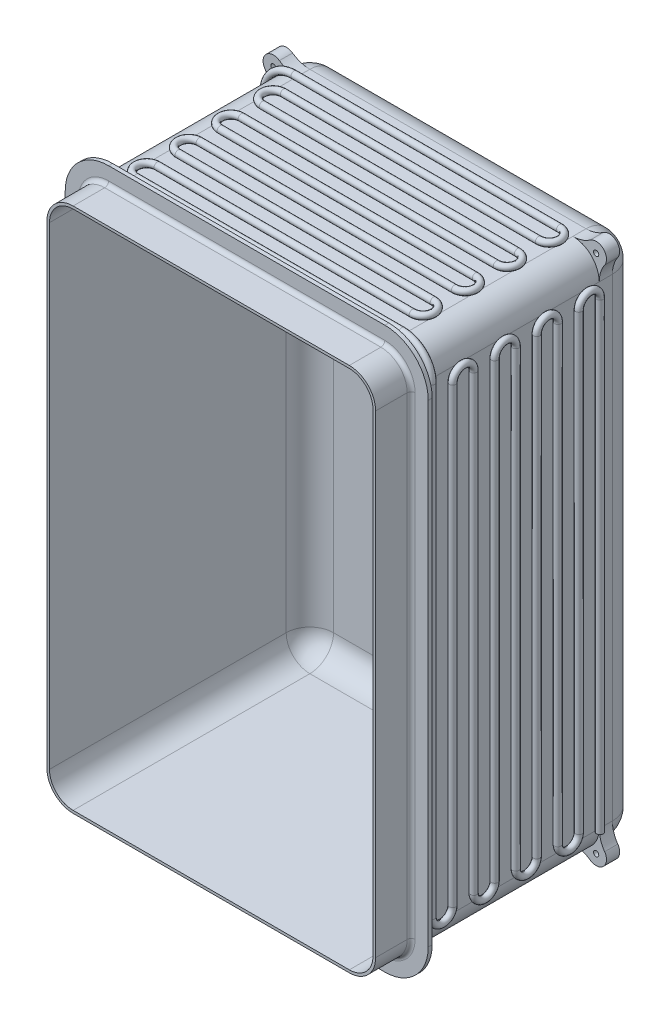
from build123d import *

# Parameters (mm, degrees)
SKIZZE1_W                       = 250
SKIZZE1_H                       = 400
AUFSATZ_LINEAR_AUSTRAGEN1_DEPTH = 200
VERRUNDUNG1_R                   = 20
WANDUNG1_T                      = -2
AUSTRAGUNG_D_NN2_PROFILE_R      = 2.5
AUSTRAGUNG_D_NN2_PROFILE_R_2    = 2
AUFSATZ_LINEAR_START            = -30
SKIZZE67_R                      = 2
AUFSATZ_LINEAR_AUSTRAGEN2_DEPTH = 10
SPIEGELN3_START                 = -30
SPIEGELN3_COPY_1_SKETCH_R       = 2
SPIEGELN3_COPY_1_DEPTH          = 10
AUFSATZ_LINEAR_START_2          = 3
AUFSATZ_LINEAR_AUSTRAGEN3_DEPTH = 3
VERRUNDUNG2_R                   = 3
VERRUNDUNG3_R                   = 3
SCHNITT_AUSTRAGUNG1_PROFILE_R   = 1.5


with BuildPart() as part:
    # Skizze1 → Aufsatz-Linear austragen1 (new body)
    with BuildSketch(Plane.XY):
        Rectangle(SKIZZE1_W, SKIZZE1_H)
    extrude(amount=AUFSATZ_LINEAR_AUSTRAGEN1_DEPTH)

    # Verrundung1
    verrundung1_edges = [part.edges().sort_by_distance(p)[0] for p in [
        (0, -200, 0),
        (-125, 0, 0),
        (0, 200, 0),
        (125, 0, 0),
        (125, -200, 100),
        (-125, -200, 100),
        (-125, 200, 100),
        (125, 200, 100),
    ]]
    fillet(verrundung1_edges, radius=VERRUNDUNG1_R)

    # Wandung1
    wandung1_openings = [part.faces().sort_by_distance(p)[0] for p in [
        (0, 0, 200),
    ]]
    offset(amount=WANDUNG1_T, openings=wandung1_openings, kind=Kind.INTERSECTION)

    # Skizze67 → Aufsatz-Linear austragen2 (add)
    with BuildSketch(Plane(origin=(0, 0, 0), x_dir=(-1, 0, 0), z_dir=(0, 0, -1)).offset(AUFSATZ_LINEAR_START)):
        with BuildLine():
            ThreePointArc((-105, 200), (-111.896608324, 201.060398611), (-118.156105762, 204.14363448))
            ThreePointArc((-118.156105762, 204.14363448), (-128.25679319, 203.25679319), (-129.14363448, 193.156105762))
            ThreePointArc((-129.14363448, 193.156105762), (-126.060398611, 186.896608324), (-125, 180))
            ThreePointArc((-125, 180), (-119.142135624, 194.142135624), (-105, 200))
        make_face()
        with Locations((-122.67766953, 197.67766953)):
            Circle(SKIZZE67_R, mode=Mode.SUBTRACT)
    aufsatz_linear_austragen2 = extrude(amount=AUFSATZ_LINEAR_AUSTRAGEN2_DEPTH)

    # Spiegeln2: Aufsatz-Linear austragen2 across plane
    add(aufsatz_linear_austragen2.mirror(Plane.ZX))

    # Spiegeln3: Aufsatz-Linear austragen2 across plane
    add(aufsatz_linear_austragen2.mirror(Plane(origin=(0, 0, 0), x_dir=(0, 0, 1), z_dir=(1, 0, 0))))

    # Spiegeln3 copy 1 sketch → Spiegeln3 copy 1 (add)
    with BuildSketch(Plane(origin=(0, 0, 0), x_dir=(1, 0, 0), z_dir=(0, 0, -1)).offset(SPIEGELN3_START)):
        with BuildLine():
            ThreePointArc((-105, 200), (-111.896608324, 201.060398611), (-118.156105762, 204.14363448))
            ThreePointArc((-118.156105762, 204.14363448), (-128.25679319, 203.25679319), (-129.14363448, 193.156105762))
            ThreePointArc((-129.14363448, 193.156105762), (-126.060398611, 186.896608324), (-125, 180))
            ThreePointArc((-125, 180), (-119.142135624, 194.142135624), (-105, 200))
        make_face()
        with Locations((-122.67766953, 197.67766953)):
            Circle(SPIEGELN3_COPY_1_SKETCH_R, mode=Mode.SUBTRACT)
    extrude(amount=SPIEGELN3_COPY_1_DEPTH)

    # Skizze69 → Aufsatz-Linear austragen3 (add)
    with BuildSketch(Plane.XY.offset(170).offset(AUFSATZ_LINEAR_START_2)):
        with BuildLine():
            Line((-105, -213), (105, -213))
            ThreePointArc((105, -213), (128.334523779, -203.334523779), (138, -180))
            Line((138, -180), (138, 180))
            ThreePointArc((138, 180), (128.334523779, 203.334523779), (105, 213))
            Line((105, 213), (-105, 213))
            ThreePointArc((-105, 213), (-128.334523779, 203.334523779), (-138, 180))
            Line((-138, 180), (-138, -180))
            ThreePointArc((-138, -180), (-128.334523779, -203.334523779), (-105, -213))
        make_face()
        with BuildLine():
            Line((-105, -200), (105, -200))
            ThreePointArc((105, -200), (119.142135624, -194.142135624), (125, -180))
            Line((125, -180), (125, 180))
            ThreePointArc((125, 180), (119.142135624, 194.142135624), (105, 200))
            Line((105, 200), (-105, 200))
            ThreePointArc((-105, 200), (-119.142135624, 194.142135624), (-125, 180))
            Line((-125, 180), (-125, -180))
            ThreePointArc((-125, -180), (-119.142135624, -194.142135624), (-105, -200))
        make_face(mode=Mode.SUBTRACT)
    extrude(amount=-AUFSATZ_LINEAR_AUSTRAGEN3_DEPTH)

    # Verrundung2
    verrundung2_edges = [part.edges().sort_by_distance(p)[0] for p in [
        (-119.142135624, -194.142135624, 173),
        (0, -200, 173),
        (119.142135624, -194.142135624, 173),
        (125, 0, 173),
        (119.142135624, 194.142135624, 173),
        (0, 200, 173),
        (-119.142135624, 194.142135624, 173),
        (-125, 0, 173),
    ]]
    fillet(verrundung2_edges, radius=VERRUNDUNG2_R)

    # Verrundung3
    verrundung3_edges = [part.edges().sort_by_distance(p)[0] for p in [
        (-119.142135624, -194.142135624, 170),
        (0, -200, 170),
        (119.142135624, -194.142135624, 170),
        (125, 0, 170),
        (119.142135624, 194.142135624, 170),
        (0, 200, 170),
        (-119.142135624, 194.142135624, 170),
        (-125, 0, 170),
    ]]
    fillet(verrundung3_edges, radius=VERRUNDUNG3_R)

    # Schnitt-Austragung1: sweep along a path in Skizze70
    with BuildLine(Plane(origin=(0, 0, 170), x_dir=(-1, 0, 0), z_dir=(0, 0, -1))) as schnitt_austragung1_path:
        Line((105, 209), (-105, 209))
        ThreePointArc((-105, 209), (-125.506096654, 200.506096654), (-134, 180))
        Line((-134, 180), (-134, -180))
        ThreePointArc((-134, -180), (-125.506096654, -200.506096654), (-105, -209))
        Line((-105, -209), (105, -209))
        ThreePointArc((105, -209), (125.506096654, -200.506096654), (134, -180))
        Line((134, -180), (134, 180))
        ThreePointArc((134, 180), (125.506096654, 200.506096654), (105, 209))
    # Schnitt-Austragung1 profile (on start of the path) → Schnitt-Austragung1 (sweep, cut)
    with BuildSketch(Plane(origin=(-105, 209, 170), x_dir=(0, 1, 0), z_dir=(1, 0, 0))):
        Circle(SCHNITT_AUSTRAGUNG1_PROFILE_R)
    sweep(path=schnitt_austragung1_path.line, mode=Mode.SUBTRACT)


with BuildPart() as body_2:
    # Austragung-Dünn2: sweep along a curve in space
    with BuildLine() as austragung_d_nn2_path:
        Line((127.5, -172, 32), (127.5, -180, 32))
        Line((127.5, 172, 32), (127.5, -172, 32))
        ThreePointArc((127.5, 172, 32), (127.5, 180, 40), (127.5, 172, 48))
        Line((127.5, -172, 48), (127.5, 172, 48))
        ThreePointArc((127.5, -172, 64), (127.5, -180, 56), (127.5, -172, 48))
        Line((127.5, 172, 64), (127.5, -172, 64))
        ThreePointArc((127.5, 172, 64), (127.5, 180, 72), (127.5, 172, 80))
        Line((127.5, -172, 80), (127.5, 172, 80))
        ThreePointArc((127.5, -172, 96), (127.5, -180, 88), (127.5, -172, 80))
        Line((127.5, 172, 96), (127.5, -172, 96))
        ThreePointArc((127.5, 172, 96), (127.5, 180, 104), (127.5, 172, 112))
        Line((127.5, -172, 112), (127.5, 172, 112))
        ThreePointArc((127.5, -172, 128), (127.5, -180, 120), (127.5, -172, 112))
        Line((127.5, 172, 128), (127.5, -172, 128))
        ThreePointArc((127.5, 172, 128), (127.5, 180, 136), (127.5, 172, 144))
        Line((127.5, -172, 144), (127.5, 172, 144))
        ThreePointArc((127.5, -172, 160), (127.5, -180, 152), (127.5, -172, 144))
        Line((127.5, -172, 160), (127.5, 180, 160))
        ThreePointArc((105, 202.5, 160), (120.909902577, 195.909902577, 160), (127.5, 180, 160))
        Line((97.000004229, 202.5, 160), (105, 202.5, 160))
        Line((97.000004229, 202.5, 160), (-97.000004229, 202.5, 160))
        ThreePointArc((-97.000004229, 202.5, 160), (-105.000004229, 202.5, 152), (-97.000004229, 202.5, 144))
        Line((97.000004229, 202.5, 144), (-97.000004229, 202.5, 144))
        ThreePointArc((97.000004229, 202.5, 144), (105.000004229, 202.5, 136), (97.000004229, 202.5, 128))
        Line((97.000004229, 202.5, 128), (-97.000004229, 202.5, 128))
        ThreePointArc((-97.000004229, 202.5, 128), (-105.000004229, 202.5, 120), (-97.000004229, 202.5, 112))
        Line((97.000004229, 202.5, 112), (-97.000004229, 202.5, 112))
        ThreePointArc((97.000004229, 202.5, 112), (105.000004229, 202.5, 104), (97.000004229, 202.5, 96))
        Line((97.000004229, 202.5, 96), (-97.000004229, 202.5, 96))
        ThreePointArc((-97.000004229, 202.5, 96), (-105.000004229, 202.5, 88), (-97.000004229, 202.5, 80))
        Line((97.000004229, 202.5, 80), (-97.000004229, 202.5, 80))
        ThreePointArc((97.000004229, 202.5, 80), (105.000004229, 202.5, 72), (97.000004229, 202.5, 64))
        Line((97.000004229, 202.5, 64), (-97.000004229, 202.5, 64))
        ThreePointArc((-97.000004229, 202.5, 64), (-105.000004229, 202.5, 56), (-97.000004229, 202.5, 48))
        Line((97.000004229, 202.5, 48), (-97.000004229, 202.5, 48))
        ThreePointArc((97.000004229, 202.5, 48), (105.000004229, 202.5, 40), (97.000004229, 202.5, 32))
        Line((-97.000004229, 202.5, 32), (97.000004229, 202.5, 32))
        Line((-97.000004229, 202.5, 32), (-105, 202.5, 32))
        ThreePointArc((-127.5, 180, 32), (-120.909902577, 195.909902577, 32), (-105, 202.5, 32))
        Line((-127.5, 180, 32), (-127.5, -172, 32))
        ThreePointArc((-127.5, -172, 32), (-127.5, -180, 40), (-127.5, -172, 48))
        Line((-127.5, -172, 48), (-127.5, 172, 48))
        ThreePointArc((-127.5, 172, 48), (-127.5, 180, 56), (-127.5, 172, 64))
        Line((-127.5, 172, 64), (-127.5, -172, 64))
        ThreePointArc((-127.5, -172, 64), (-127.5, -180, 72), (-127.5, -172, 80))
        Line((-127.5, -172, 80), (-127.5, 172, 80))
        ThreePointArc((-127.5, 172, 80), (-127.5, 180, 88), (-127.5, 172, 96))
        Line((-127.5, 172, 96), (-127.5, -172, 96))
        ThreePointArc((-127.5, -172, 96), (-127.5, -180, 104), (-127.5, -172, 112))
        Line((-127.5, -172, 112), (-127.5, 172, 112))
        ThreePointArc((-127.5, 172, 112), (-127.5, 180, 120), (-127.5, 172, 128))
        Line((-127.5, 172, 128), (-127.5, -172, 128))
        ThreePointArc((-127.5, -172, 128), (-127.5, -180, 136), (-127.5, -172, 144))
        Line((-127.5, -172, 144), (-127.5, 172, 144))
        ThreePointArc((-127.5, 172, 144), (-127.5, 180, 152), (-127.5, 172, 160))
        Line((-127.5, 172, 160), (-127.5, -180, 160))
        ThreePointArc((-127.5, -180, 160), (-120.909902577, -195.909902577, 160), (-105, -202.5, 160))
        Line((97, -202.5, 160), (-105, -202.5, 160))
        ThreePointArc((97, -202.5, 160), (105, -202.5, 152), (97, -202.5, 144))
        Line((-97, -202.5, 144), (97, -202.5, 144))
        ThreePointArc((-97, -202.5, 144), (-105, -202.5, 136), (-97, -202.5, 128))
        Line((-97, -202.5, 128), (97, -202.5, 128))
        ThreePointArc((97, -202.5, 128), (105, -202.5, 120), (97, -202.5, 112))
        Line((-97, -202.5, 112), (97, -202.5, 112))
        ThreePointArc((-97, -202.5, 112), (-105, -202.5, 104), (-97, -202.5, 96))
        Line((-97, -202.5, 96), (97, -202.5, 96))
        ThreePointArc((97, -202.5, 96), (105, -202.5, 88), (97, -202.5, 80))
        Line((-97, -202.5, 80), (97, -202.5, 80))
        ThreePointArc((-97, -202.5, 80), (-105, -202.5, 72), (-97, -202.5, 64))
        Line((-97, -202.5, 64), (97, -202.5, 64))
        ThreePointArc((97, -202.5, 64), (105, -202.5, 56), (97, -202.5, 48))
        Line((-97, -202.5, 48), (97, -202.5, 48))
        ThreePointArc((-97, -202.5, 48), (-105, -202.5, 40), (-97, -202.5, 32))
        Line((-97, -202.5, 32), (105, -202.5, 32))
    # Austragung-Dünn2 profile (on start of the path) → Austragung-Dünn2 (sweep)
    with BuildSketch(Plane(origin=(105, -202.5, 32), x_dir=(0, 0, -1), z_dir=(-1, 0, 0))):
        Circle(AUSTRAGUNG_D_NN2_PROFILE_R)
        Circle(AUSTRAGUNG_D_NN2_PROFILE_R_2, mode=Mode.SUBTRACT)
    sweep(path=austragung_d_nn2_path.line)


solid = Compound([part.part, body_2.part])
